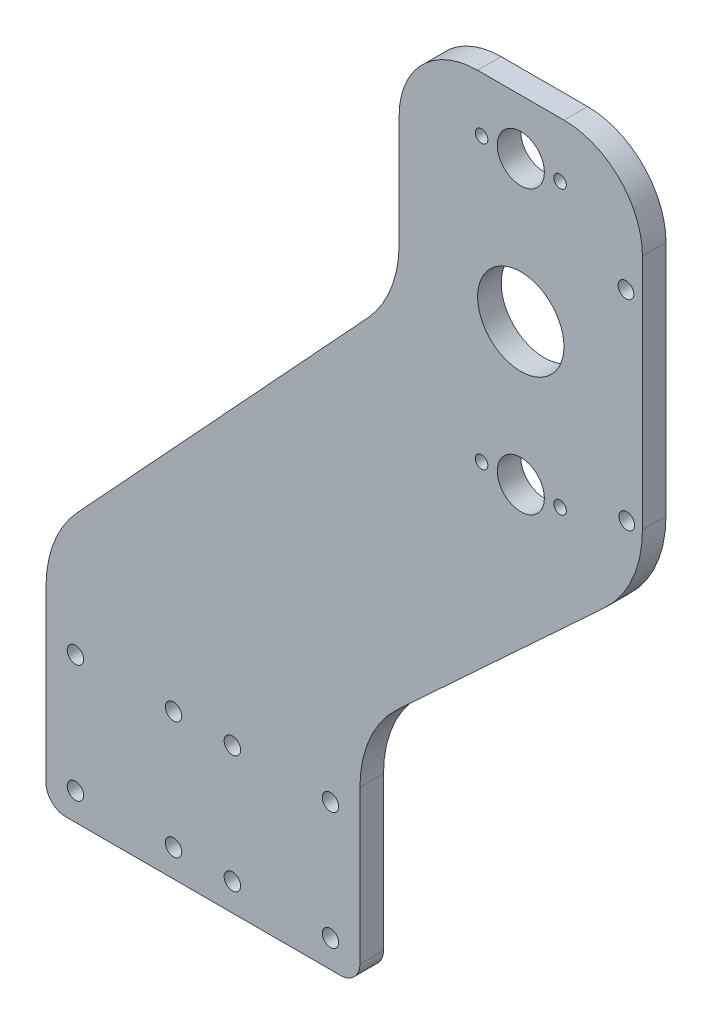
from build123d import *

# Parameters (mm, degrees)
SKETCH1_R           = 2.1
SKETCH1_R_2         = 6
SKETCH1_R_3         = 11
SKETCH1_R_4         = 2
SKETCH1_R_5         = 1.6
BOSS_EXTRUDE1_DEPTH = 6


with BuildPart() as part:
    # Sketch1 → Boss-Extrude1 (new body)
    with BuildSketch(Plane.XY):
        with BuildLine():
            Line((-58.426247288, -99.197523475), (11.573752712, -99.197523475))
            ThreePointArc((11.573752712, -99.197523475), (15.109286618, -97.733057381), (16.573752712, -94.197523475))
            Line((16.573752712, -94.197523475), (16.573752712, -55.206132823))
            ThreePointArc((16.573752712, -55.206132823), (19.086141827, -43.188177597), (26.202502566, -33.18314103))
            Line((26.202502566, -33.18314103), (78.945002858, 15.603630397))
            ThreePointArc((78.945002858, 15.603630397), (86.061363597, 25.608666964), (88.573752712, 37.62662219))
            Line((88.573752712, 37.62662219), (88.573752712, 98.05237335))
            ThreePointArc((88.573752712, 98.05237335), (82.715888336, 112.194508974), (68.573752712, 118.05237335))
            Line((68.573752712, 118.05237335), (46.573752712, 118.05237335))
            ThreePointArc((46.573752712, 118.05237335), (32.431617088, 112.194508974), (26.573752712, 98.05237335))
            Line((26.573752712, 98.05237335), (26.573752712, 69.804033413))
            ThreePointArc((26.573752712, 69.804033413), (24.507075321, 58.861936355), (18.591786844, 49.427424937))
            Line((18.591786844, 49.427424937), (-55.44428142, -30.572575063))
            ThreePointArc((-55.44428142, -30.572575063), (-61.359569897, -40.00708648), (-63.426247288, -50.949183538))
            Line((-63.426247288, -50.949183538), (-63.426247288, -94.197523475))
            ThreePointArc((-63.426247288, -94.197523475), (-61.961781194, -97.733057381), (-58.426247288, -99.197523475))
        make_face()
        with Locations((-55.926247288, -62.197523475)):
            Circle(SKETCH1_R, mode=Mode.SUBTRACT)
        with Locations((-30.926247288, -62.197523475)):
            Circle(SKETCH1_R, mode=Mode.SUBTRACT)
        with Locations((-30.926247288, -92.197523475)):
            Circle(SKETCH1_R, mode=Mode.SUBTRACT)
        with Locations((-55.926247288, -92.197523475)):
            Circle(SKETCH1_R, mode=Mode.SUBTRACT)
        with Locations((9.073752712, -92.197523475)):
            Circle(SKETCH1_R, mode=Mode.SUBTRACT)
        with Locations((-15.926247288, -92.197523475)):
            Circle(SKETCH1_R, mode=Mode.SUBTRACT)
        with Locations((-15.926247288, -62.197523475)):
            Circle(SKETCH1_R, mode=Mode.SUBTRACT)
        with Locations((9.073752712, -62.197523475)):
            Circle(SKETCH1_R, mode=Mode.SUBTRACT)
        with Locations((57.573752712, 104.05237335)):
            Circle(SKETCH1_R_2, mode=Mode.SUBTRACT)
        with Locations((57.573752712, 32.11237335)):
            Circle(SKETCH1_R_2, mode=Mode.SUBTRACT)
        with Locations((57.573752712, 68.08237335)):
            Circle(SKETCH1_R_3, mode=Mode.SUBTRACT)
        with Locations((84.573752712, 37.62662219)):
            Circle(SKETCH1_R_4, mode=Mode.SUBTRACT)
        with Locations((84.375885899, 88.528341433)):
            Circle(SKETCH1_R_4, mode=Mode.SUBTRACT)
        with Locations((47.573752712, 104.05237335)):
            Circle(SKETCH1_R_5, mode=Mode.SUBTRACT)
        with Locations((47.573752712, 32.11237335)):
            Circle(SKETCH1_R_5, mode=Mode.SUBTRACT)
        with Locations((67.573752712, 104.05237335)):
            Circle(SKETCH1_R_5, mode=Mode.SUBTRACT)
        with Locations((67.573752712, 32.11237335)):
            Circle(SKETCH1_R_5, mode=Mode.SUBTRACT)
    extrude(amount=BOSS_EXTRUDE1_DEPTH)


solid = part.part
